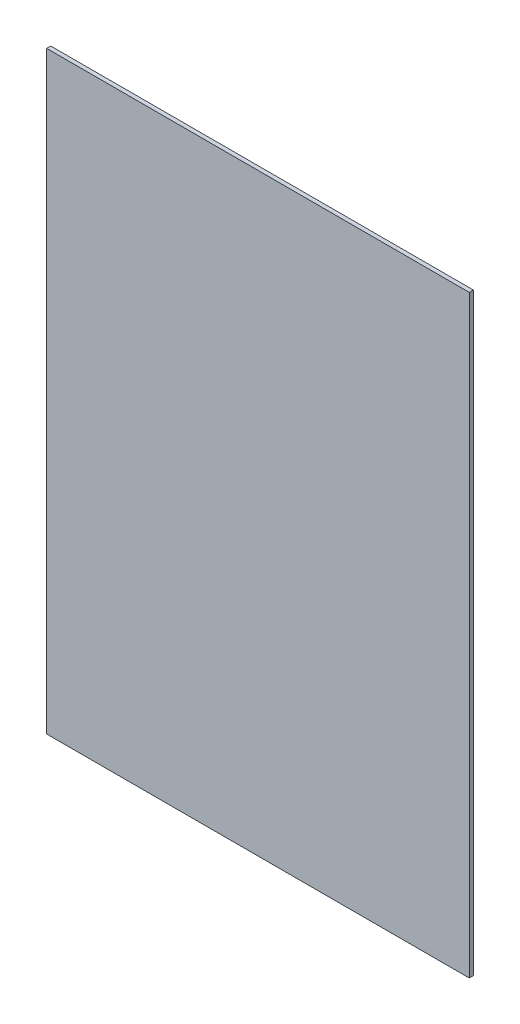
from build123d import *

# Parameters (mm, degrees)
SKETCH_2_W      = 620.3
SKETCH_2_H      = 871.6
EXTRUDE_1_DEPTH = 6


with BuildPart() as part:
    # Эскиз2 → Бобышка-Вытянуть1 (new body)
    with BuildSketch(Plane.XY):
        with Locations((828.15, 0)):
            Rectangle(SKETCH_2_W, SKETCH_2_H)
    extrude(amount=-EXTRUDE_1_DEPTH)


solid = part.part
